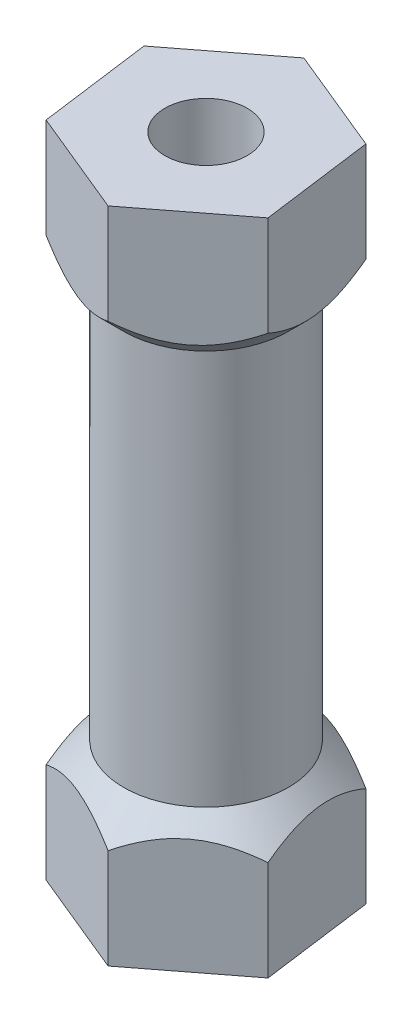
from build123d import *

# Parameters (mm, degrees)
SKETCH_1_R          = 2.5
EXTRUDE_1_DEPTH     = 20
EXTRUDE_2_DEPTH     = 3
EXTRUDE_3_DEPTH     = 3
CHAMFER_1_SIZE      = 1
SKETCH_4_R          = 1.25
CUT_EXTRUDE_1_DEPTH = 8
CUT_EXTRUDE_START   = 8
SKETCH_5_R          = 1.25
CUT_EXTRUDE_2_DEPTH = 8


with BuildPart() as part:
    # 草图1 → 凸台-拉伸1 (new body)
    with BuildSketch(Plane(origin=(0, 0, 0), x_dir=(1, 0, 0), z_dir=(0, 1, 0))):
        with Locations(Location((0, 0, 0), (0, 0, 270))):
            Circle(SKETCH_1_R)
    extrude(amount=EXTRUDE_1_DEPTH)

    # 草图2 → 凸台-拉伸2 (add)
    with BuildSketch(Plane(origin=(0, 20, 0), x_dir=(1, 0, 0), z_dir=(0, 1, 0))):
        Polygon((3.202903935, -1.319623577), (2.744279509, 2.113984385), (-0.458624426, 3.433607962), (-3.202903935, 1.319623577), (-2.744279509, -2.113984385), (0.458624426, -3.433607962), align=None)
    extrude(amount=-EXTRUDE_2_DEPTH)

    # 草图3 → 凸台-拉伸3 (add)
    with BuildSketch(Plane.XZ):
        Polygon((3.202903935, 1.319623577), (0.458624426, 3.433607962), (-2.744279509, 2.113984385), (-3.202903935, -1.319623577), (-0.458624426, -3.433607962), (2.744279509, -2.113984385), align=None)
    extrude(amount=-EXTRUDE_3_DEPTH)

    # 倒角1
    # the kernel refuses this chamfer: 1 mm, written as the material it adds along each edge
    with BuildSketch(Plane(origin=(0, 17, 0), x_dir=(0, 0, 1), z_dir=(1, 0, 0))) as chamfer_1_piece_1_section:
        Polygon((2.5, CHAMFER_1_SIZE), (2.5 + CHAMFER_1_SIZE, 0), (2.5, 0), align=None)
    chamfer_1_piece_1 = revolve(axis=Axis((0, 17, 0), (0, -1, 0)), mode=Mode.PRIVATE)
    chamfer_1_piece_1 = split(chamfer_1_piece_1, bisect_by=Plane(origin=(2.585980682, 16.482096178, -3.299128656), z_dir=(-0.9911972405355005, 0, 0.13239346794615373)), keep=Keep.TOP, mode=Mode.PRIVATE)
    chamfer_1_piece_1 = split(chamfer_1_piece_1, bisect_by=Plane(origin=(3.258731824, 16.482096178, 1.276618014), z_dir=(-0.61025472680424, 0, -0.7922052564917015)), keep=Keep.TOP, mode=Mode.PRIVATE)
    chamfer_1_piece_1 = split(chamfer_1_piece_1, bisect_by=Plane(origin=(0.102470937, 16.482096178, -3.202431915), z_dir=(-0.3809425137312606, 0, 0.924598724437855)), keep=Keep.TOP, mode=Mode.PRIVATE)
    chamfer_1_piece_1 = split(chamfer_1_piece_1, bisect_by=Plane(origin=(-2.183184145, 16.482096178, 2.345160432), z_dir=(0.38094251373126053, 0, -0.924598724437855)), keep=Keep.TOP, mode=Mode.PRIVATE)
    chamfer_1_piece_1 = split(chamfer_1_piece_1, bisect_by=Plane(origin=(-0.402796537, 16.482096178, -3.476613525), z_dir=(0.6102547268042401, 0, 0.7922052564917015)), keep=Keep.TOP, mode=Mode.PRIVATE)
    chamfer_1_piece_1 = split(chamfer_1_piece_1, bisect_by=Plane(origin=(-3.361202761, 16.482096178, -2.504767848), z_dir=(0.9911972405355005, 0, -0.1323934679461537)), keep=Keep.TOP, mode=Mode.PRIVATE)
    add(chamfer_1_piece_1)
    with BuildSketch(Plane(origin=(0, 3, 0), x_dir=(0, 0, 1), z_dir=(1, 0, 0))) as chamfer_1_piece_2_section:
        Polygon((2.5 + CHAMFER_1_SIZE, 0), (2.5, -CHAMFER_1_SIZE), (2.5, 0), align=None)
    chamfer_1_piece_2 = revolve(axis=Axis((0, 3, 0), (0, -1, 0)), mode=Mode.PRIVATE)
    chamfer_1_piece_2 = split(chamfer_1_piece_2, bisect_by=Plane(origin=(3.258731824, 3.517903822, 1.276618014), z_dir=(-0.61025472680424, 0, -0.7922052564917015)), keep=Keep.TOP, mode=Mode.PRIVATE)
    chamfer_1_piece_2 = split(chamfer_1_piece_2, bisect_by=Plane(origin=(2.585980682, 3.517903822, -3.299128656), z_dir=(-0.9911972405355005, 0, 0.13239346794615373)), keep=Keep.TOP, mode=Mode.PRIVATE)
    chamfer_1_piece_2 = split(chamfer_1_piece_2, bisect_by=Plane(origin=(-2.183184145, 3.517903822, 2.345160432), z_dir=(0.38094251373126053, 0, -0.924598724437855)), keep=Keep.TOP, mode=Mode.PRIVATE)
    chamfer_1_piece_2 = split(chamfer_1_piece_2, bisect_by=Plane(origin=(0.102470937, 3.517903822, -3.202431915), z_dir=(-0.3809425137312606, 0, 0.924598724437855)), keep=Keep.TOP, mode=Mode.PRIVATE)
    chamfer_1_piece_2 = split(chamfer_1_piece_2, bisect_by=Plane(origin=(-3.361202761, 3.517903822, -2.504767848), z_dir=(0.9911972405355005, 0, -0.1323934679461537)), keep=Keep.TOP, mode=Mode.PRIVATE)
    chamfer_1_piece_2 = split(chamfer_1_piece_2, bisect_by=Plane(origin=(-0.402796537, 3.517903822, -3.476613525), z_dir=(0.6102547268042401, 0, 0.7922052564917015)), keep=Keep.TOP, mode=Mode.PRIVATE)
    add(chamfer_1_piece_2)

    # 草图4 → 切除-拉伸1 (cut)
    with BuildSketch(Plane(origin=(0, 0, 0), x_dir=(-1, 0, 0), z_dir=(0, 1, 0))):
        with Locations(Location((0, 0, 0), (0, 0, 90))):
            Circle(SKETCH_4_R)
    extrude(amount=CUT_EXTRUDE_1_DEPTH, mode=Mode.SUBTRACT)

    # 草图5 → 切除-拉伸2 (cut)
    with BuildSketch(Plane(origin=(0, 20, 0), x_dir=(-1, 0, 0), z_dir=(0, -1, 0)).offset(CUT_EXTRUDE_START)):
        with Locations(Location((0, 0, 0), (0, 0, 270))):
            Circle(SKETCH_5_R)
    extrude(amount=-CUT_EXTRUDE_2_DEPTH, mode=Mode.SUBTRACT)


solid = part.part
